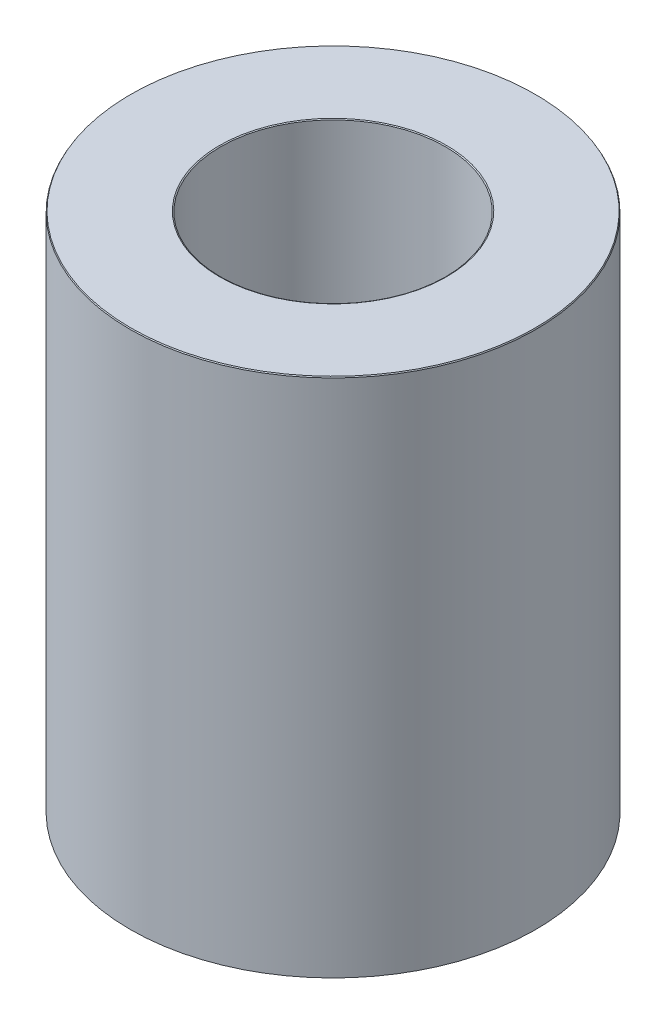
from build123d import *
from OCP.BRepFilletAPI import BRepFilletAPI_MakeChamfer

# Parameters (mm, degrees)
SKETCH1_R           = 45
BOSS_EXTRUDE1_DEPTH = 115.61203461
SKETCH2_R           = 24.972732242
CUT_EXTRUDE1_DEPTH  = 132.970233563
CHAMFER1_SIZE       = 0.235817224
CHAMFER1_SIZE2      = 0.136149138


with BuildPart() as part:
    # Sketch1 → Boss-Extrude1 (new body)
    with BuildSketch(Plane(origin=(0, 0, 0), x_dir=(1, 0, 0), z_dir=(0, 1, 0))):
        Circle(SKETCH1_R)
    extrude(amount=BOSS_EXTRUDE1_DEPTH)

    # Sketch2 → Cut-Extrude1 (cut, through all)
    with BuildSketch(Plane(origin=(0, 0, 0), x_dir=(1, 0, 0), z_dir=(0, 1, 0))):
        Circle(SKETCH2_R)
    extrude(amount=CUT_EXTRUDE1_DEPTH, mode=Mode.SUBTRACT)

    # Chamfer1: one chamfer whose edges measure the first distance from different faces: ONE call of the kernel's chamfer builder (chamfer() names one face for all edges)
    chamfer1_edges_1 = [part.edges().sort_by_distance(p)[0] for p in [
        (-24.972732242, 115.61203461, 0),
    ]]
    chamfer1_side_1 = [part.faces().sort_by_distance(p)[0] for p in [
        (-43.727207794, 115.61203461, 0),
    ]]
    chamfer1_edges_2 = [part.edges().sort_by_distance(p)[0] for p in [
        (-24.972732242, 0, 0),
    ]]
    chamfer1_side_2 = [part.faces().sort_by_distance(p)[0] for p in [
        (-24.972732242, 57.806017305, 0),
    ]]
    chamfer1_edges_3 = [part.edges().sort_by_distance(p)[0] for p in [
        (-45, 0, 0),
    ]]
    chamfer1_side_3 = [part.faces().sort_by_distance(p)[0] for p in [
        (-43.727207794, 0, 0),
    ]]
    chamfer1_edges_4 = [part.edges().sort_by_distance(p)[0] for p in [
        (-45, 115.61203461, 0),
    ]]
    chamfer1_side_4 = [part.faces().sort_by_distance(p)[0] for p in [
        (-45, 57.806017305, 0),
    ]]
    chamfer1 = BRepFilletAPI_MakeChamfer(part.part.solid().wrapped)
    for e in chamfer1_edges_1:
        chamfer1.Add(CHAMFER1_SIZE, CHAMFER1_SIZE2, e.wrapped, chamfer1_side_1[0].wrapped)  # the first distance lies on this face
    for e in chamfer1_edges_2:
        chamfer1.Add(CHAMFER1_SIZE, CHAMFER1_SIZE2, e.wrapped, chamfer1_side_2[0].wrapped)  # the first distance lies on this face
    for e in chamfer1_edges_3:
        chamfer1.Add(CHAMFER1_SIZE, CHAMFER1_SIZE2, e.wrapped, chamfer1_side_3[0].wrapped)  # the first distance lies on this face
    for e in chamfer1_edges_4:
        chamfer1.Add(CHAMFER1_SIZE, CHAMFER1_SIZE2, e.wrapped, chamfer1_side_4[0].wrapped)  # the first distance lies on this face
    add(Compound.cast(chamfer1.Shape()), mode=Mode.REPLACE)


solid = part.part
